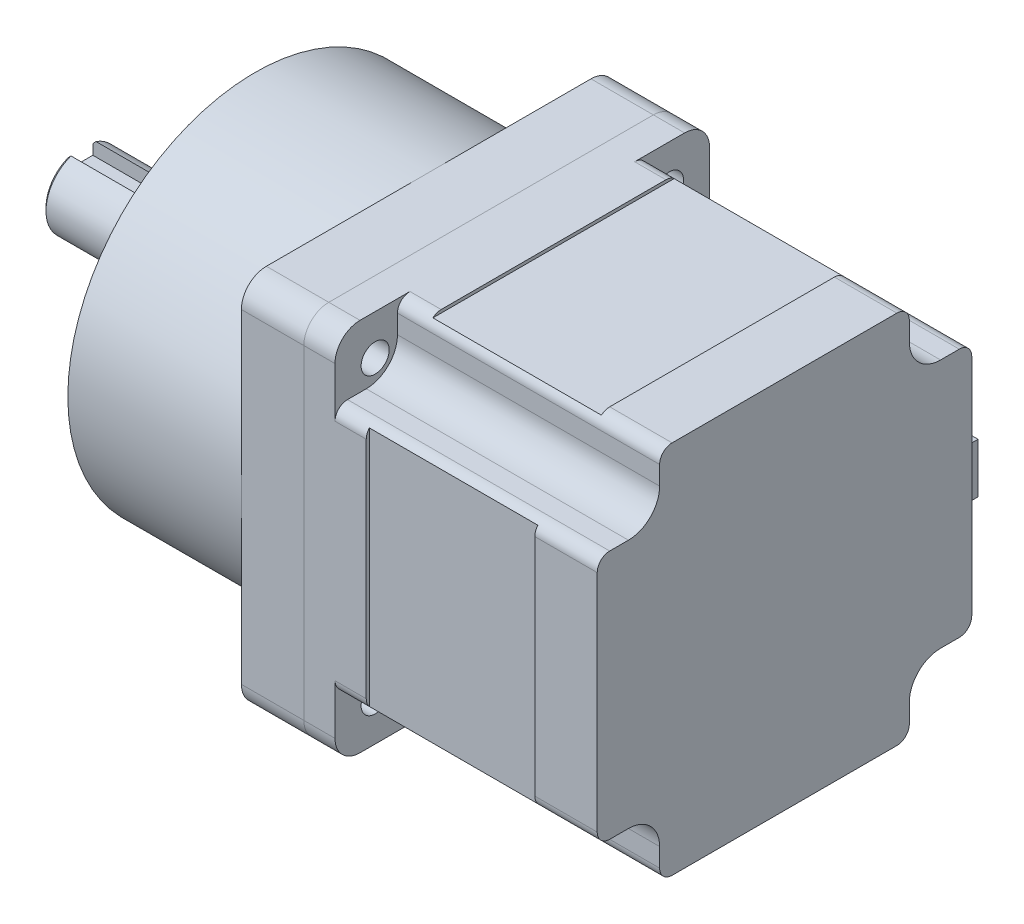
from build123d import *

# Parameters (mm, degrees)
SKETCH_1_W                  = 60
SKETCH_1_H                  = 60
EXTRUDE_1_DEPTH             = 23.5
SKETCH_7_W                  = 60
SKETCH_7_H                  = 60
SKETCH_7_W_2                = 59
SKETCH_7_H_2                = 59
CUT_EXTRUDE_1_DEPTH         = 13.5
SKETCH_2_R                  = 19.05
EXTRUDE_2_DEPTH             = 1.6
SKETCH_3_R                  = 4
EXTRUDE_3_DEPTH             = 22.4
SKETCH_10_W                 = 3
SKETCH_10_H                 = 8
EXTRUDE_4_DEPTH             = 3
SKETCH_14_W                 = 4.023193039
SKETCH_14_H                 = 9.052092363
CUT_EXTRUDE_3_DEPTH         = 20
SKETCH_12_W                 = 10
SKETCH_12_H                 = 10
CUT_EXTRUDE_2_DEPTH         = 42
SKETCH_15_R                 = 0.5
EXTRUDE_5_DEPTH             = 10
FILLET_2_R                  = 5
FILLET_START                = -18.5
FILLET_3_DEPTH              = 42.5
HOLE_WIZARD_4_5_4_5_1_D     = 4.5
HOLE_WIZARD_4_5_4_5_1_DEPTH = 10
HOLE_WIZARD_4_5_4_5_1_TIP   = 1.351936393
FILLET_1_R                  = 4
SKETCH_17_R                 = 2.25
EXTRUDE_7_DEPTH             = 10
SKETCH_18_R                 = 30
EXTRUDE_8_DEPTH             = 27.8
SKETCH_19_R                 = 16
EXTRUDE_9_DEPTH             = 2
SKETCH_20_R                 = 6
EXTRUDE_10_DEPTH            = 26
CUT_EXTRUDE_START           = 3.5
CUT_EXTRUDE_4_DEPTH         = 26
CHAMFER_1_SIZE              = 0.5
HOLE_WIZARD_M5_1_AT_2_COUNT = 2
HOLE_WIZARD_M5_1_AT_2_PITCH = 31.819805153
HOLE_WIZARD_M5_1_AT_3_COUNT = 2
HOLE_WIZARD_M5_1_AT_3_PITCH = 45
HOLE_WIZARD_M5_1_AT_4_COUNT = 2
HOLE_WIZARD_M5_1_AT_4_PITCH = 31.819805153


with BuildPart() as part:
    # 草图1 → 凸台-拉伸1 (new, symmetric)
    with BuildSketch(Plane(origin=(0, 0, 0), x_dir=(0, 0, -1), z_dir=(1, 0, 0))):
        Rectangle(SKETCH_1_W, SKETCH_1_H)
    extrude(amount=EXTRUDE_1_DEPTH, both=True)

    # 草图7 → 切除-拉伸1 (cut, symmetric)
    with BuildSketch(Plane(origin=(0, 0, 0), x_dir=(0, 0, -1), z_dir=(1, 0, 0))):
        Rectangle(SKETCH_7_W, SKETCH_7_H)
        Rectangle(SKETCH_7_W_2, SKETCH_7_H_2, mode=Mode.SUBTRACT)
    extrude(amount=CUT_EXTRUDE_1_DEPTH, both=True, mode=Mode.SUBTRACT)

    # 草图2 → 凸台-拉伸2 (add)
    with BuildSketch(Plane.ZY.offset(23.5)):
        with Locations(Location((0, 0, 0), (0, 0, 180))):
            Circle(SKETCH_2_R)
    extrude(amount=EXTRUDE_2_DEPTH)

    # 草图3 → 凸台-拉伸3 (add)
    with BuildSketch(Plane.ZY.offset(25.1)):
        Circle(SKETCH_3_R)
    extrude(amount=EXTRUDE_3_DEPTH)

    # 草图10 → 凸台-拉伸4 (add)
    with BuildSketch(Plane(origin=(0, 0, -30), x_dir=(-1, 0, 0), z_dir=(0, 0, -1))):
        with Locations((-20, 0)):
            Rectangle(SKETCH_10_W, SKETCH_10_H)
    extrude(amount=EXTRUDE_4_DEPTH)

    # 草图14 → 切除-拉伸3 (cut)
    with BuildSketch(Plane.ZY.offset(47.5)):
        with Locations((-5.51159652, -0.194241877)):
            Rectangle(SKETCH_14_W, SKETCH_14_H)
    extrude(amount=-CUT_EXTRUDE_3_DEPTH, mode=Mode.SUBTRACT)

    # 草图12 → 切除-拉伸2 (cut)
    with BuildSketch(Plane(origin=(23.5, 0, 0), x_dir=(0, 0, -1), z_dir=(1, 0, 0))):
        with Locations((25, -25)):
            Rectangle(SKETCH_12_W, SKETCH_12_H)
        with Locations((-25, -25)):
            Rectangle(SKETCH_12_W, SKETCH_12_H)
        with Locations((-25, 25)):
            Rectangle(SKETCH_12_W, SKETCH_12_H)
        with Locations((25, 25)):
            Rectangle(SKETCH_12_W, SKETCH_12_H)
    extrude(amount=-CUT_EXTRUDE_2_DEPTH, mode=Mode.SUBTRACT)

    # 草图15 → 凸台-拉伸5 (add)
    with BuildSketch(Plane.ZY.offset(-18.5)):
        with Locations(Location((-31.5, -2.5, 0), (0, 0, 90))):
            Circle(SKETCH_15_R)
        with Locations(Location((-31.5, -1, 0), (0, 0, 90))):
            Circle(SKETCH_15_R)
        with Locations(Location((-31.5, 0.5, 0), (0, 0, 90))):
            Circle(SKETCH_15_R)
        with Locations(Location((-31.5, 2, 0), (0, 0, 90))):
            Circle(SKETCH_15_R)
    extrude(amount=EXTRUDE_5_DEPTH)

    # 圆角2
    fillet_2_edges = [part.edges().sort_by_distance(p)[0] for p in [
        (2.5, -20, 20),
        (2.5, 20, 20),
        (2.5, 20, -20),
        (2.5, -20, -20),
    ]]
    fillet(fillet_2_edges, radius=FILLET_2_R)

    # 圆角3: read off the stored shape, not the designer's step
    # 圆角3 outline → 圆角3 (cut)
    with BuildSketch(Plane.YZ.offset(FILLET_START)):
        with BuildLine():
            Line((30, 18), (30, 20))
            Line((30, 20), (28, 20))
            ThreePointArc((28, 20), (29.414213562, 19.414213562), (30, 18))
        make_face()
        with BuildLine():
            Line((30, -20), (30, -18))
            ThreePointArc((30, -18), (29.414213562, -19.414213562), (28, -20))
            Line((28, -20), (30, -20))
        make_face()
        with BuildLine():
            Line((20, 30), (18, 30))
            ThreePointArc((18, 30), (19.414213562, 29.414213562), (20, 28))
            Line((20, 28), (20, 30))
        make_face()
        with BuildLine():
            Line((18, -30), (20, -30))
            Line((20, -30), (20, -28))
            ThreePointArc((20, -28), (19.414213562, -29.414213562), (18, -30))
        make_face()
        with BuildLine():
            Line((-18, 30), (-20, 30))
            Line((-20, 30), (-20, 28))
            ThreePointArc((-20, 28), (-19.414213562, 29.414213562), (-18, 30))
        make_face()
        with BuildLine():
            Line((-20, -30), (-18, -30))
            ThreePointArc((-18, -30), (-19.414213562, -29.414213562), (-20, -28))
            Line((-20, -28), (-20, -30))
        make_face()
        with BuildLine():
            Line((-30, 20), (-30, 18))
            ThreePointArc((-30, 18), (-29.414213562, 19.414213562), (-28, 20))
            Line((-28, 20), (-30, 20))
        make_face()
        with BuildLine():
            Line((-30, -18), (-30, -20))
            Line((-30, -20), (-28, -20))
            ThreePointArc((-28, -20), (-29.414213562, -19.414213562), (-30, -18))
        make_face()
    extrude(amount=FILLET_3_DEPTH, mode=Mode.SUBTRACT)

    # Ø4.5 (4.5) 直径孔1
    with Locations(Plane.ZY.offset(23.5)):
        with Locations((-23.57, 23.57), (23.57, 23.57), (23.57, -23.57), (-23.57, -23.57)):
            Hole(HOLE_WIZARD_4_5_4_5_1_D / 2, depth=HOLE_WIZARD_4_5_4_5_1_DEPTH)
            with Locations((0, 0, -(HOLE_WIZARD_4_5_4_5_1_DEPTH + HOLE_WIZARD_4_5_4_5_1_TIP / 2))):  # 118° drill point
                Cone(0, HOLE_WIZARD_4_5_4_5_1_D / 2, HOLE_WIZARD_4_5_4_5_1_TIP, mode=Mode.SUBTRACT)

    # 圆角1
    fillet_1_edges = [part.edges().sort_by_distance(p)[0] for p in [
        (-21, -30, 30),
        (-21, 30, 30),
        (-21, 30, -30),
        (-21, -30, -30),
    ]]
    fillet(fillet_1_edges, radius=FILLET_1_R)


with BuildPart() as body_2:
    # 草图17 → 凸台-拉伸7 (new body)
    with BuildSketch(Plane.ZY.offset(23.5)):
        with BuildLine():
            Line((-30, -26), (-30, 26))
            ThreePointArc((-30, 26), (-28.828427125, 28.828427125), (-26, 30))
            Line((-26, 30), (26, 30))
            ThreePointArc((26, 30), (28.828427125, 28.828427125), (30, 26))
            Line((30, 26), (30, -26))
            ThreePointArc((30, -26), (28.828427125, -28.828427125), (26, -30))
            Line((26, -30), (-26, -30))
            ThreePointArc((-26, -30), (-28.828427125, -28.828427125), (-30, -26))
        make_face()
        with Locations((-23.57, -23.57)):
            Circle(SKETCH_17_R, mode=Mode.SUBTRACT)
        with Locations((-23.57, 23.57)):
            Circle(SKETCH_17_R, mode=Mode.SUBTRACT)
        with Locations((23.57, 23.57)):
            Circle(SKETCH_17_R, mode=Mode.SUBTRACT)
        with Locations((23.57, -23.57)):
            Circle(SKETCH_17_R, mode=Mode.SUBTRACT)
    extrude(amount=EXTRUDE_7_DEPTH)

    # 草图18 → 凸台-拉伸8 (add)
    with BuildSketch(Plane.ZY.offset(33.5)):
        Circle(SKETCH_18_R)
    extrude(amount=EXTRUDE_8_DEPTH)

    # 草图19 → 凸台-拉伸9 (add)
    with BuildSketch(Plane.ZY.offset(61.3)):
        Circle(SKETCH_19_R)
    extrude(amount=EXTRUDE_9_DEPTH)

    # 草图20 → 凸台-拉伸10 (add)
    with BuildSketch(Plane.ZY.offset(63.3)):
        with Locations(Location((0, 0, 0), (0, 0, 180))):
            Circle(SKETCH_20_R)
    extrude(amount=EXTRUDE_10_DEPTH)

    # 草图21 → 切除-拉伸4 (cut)
    with BuildSketch(Plane(origin=(0, 0, 0), x_dir=(1, 0, 0), z_dir=(0, 1, 0)).offset(CUT_EXTRUDE_START)):
        with BuildLine():
            Line((-89.3, 2), (-71.3, 2))
            ThreePointArc((-71.3, 2), (-69.3, 0), (-71.3, -2))
            Line((-71.3, -2), (-89.3, -2))
            ThreePointArc((-89.3, -2), (-91.3, 0), (-89.3, 2))
        make_face()
    extrude(amount=CUT_EXTRUDE_4_DEPTH, mode=Mode.SUBTRACT)

    # 倒角1
    chamfer_1_edges = [body_2.edges().sort_by_distance(p)[0] for p in [
        (-89.3, -4.898979486, 3.464101615),
    ]]
    chamfer(chamfer_1_edges, length=CHAMFER_1_SIZE)

    # 草图23 → M5 螺纹孔1 (revolve, cut)
    with BuildSketch(Plane(origin=(-61.3, 15.909902577, -15.909902577), x_dir=(0, 0, 1), z_dir=(0, 1, 0))):
        Polygon((0, 0), (0, 13.6618073), (2.1, 12.4), (2.1, 0), align=None)
    hole_wizard_m5_1 = revolve(axis=Axis((-67.65, 15.909902577, -15.909902577), (1, 0, 0)), mode=Mode.SUBTRACT)

    # M5 螺纹孔1 at 2: M5 螺纹孔1 ×2
    with Locations(*[(0, 0, i * HOLE_WIZARD_M5_1_AT_2_PITCH) for i in range(1, HOLE_WIZARD_M5_1_AT_2_COUNT)]):
        add(hole_wizard_m5_1, mode=Mode.SUBTRACT)

    # M5 螺纹孔1 at 3: M5 螺纹孔1 ×2
    with Locations(*[Vector(0, -0.7071067811865475, 0.7071067811865477) * (i * HOLE_WIZARD_M5_1_AT_3_PITCH) for i in range(1, HOLE_WIZARD_M5_1_AT_3_COUNT)]):
        add(hole_wizard_m5_1, mode=Mode.SUBTRACT)

    # M5 螺纹孔1 at 4: M5 螺纹孔1 ×2
    with Locations(*[(0, -i * HOLE_WIZARD_M5_1_AT_4_PITCH, 0) for i in range(1, HOLE_WIZARD_M5_1_AT_4_COUNT)]):
        add(hole_wizard_m5_1, mode=Mode.SUBTRACT)


solid = Compound([part.part, body_2.part])
